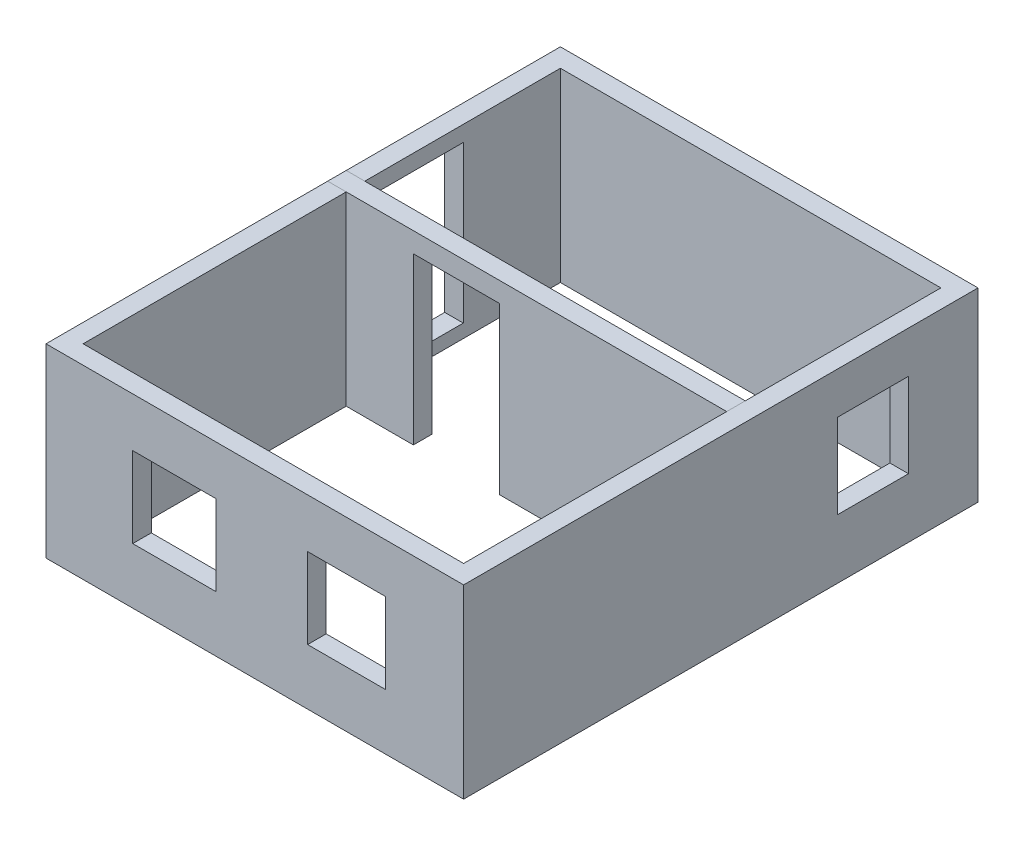
from build123d import *

# Parameters (mm, degrees)
EXTRUDE_1_OUTLINE_W   = 4500
EXTRUDE_1_OUTLINE_H   = 5543
EXTRUDE_1_OUTLINE_W_2 = 4100
EXTRUDE_1_OUTLINE_H_2 = 5143
EXTRUDE_1_DEPTH       = 2000
EXTRUDE_1_2_OUTLINE_W = 4500
EXTRUDE_1_2_OUTLINE_H = 200
EXTRUDE_1_2_DEPTH     = 2000
SKETCH_3_W            = 894.880767268
SKETCH_3_H            = 867.76316826
SKETCH_3_W_2          = 840.645569252
CUT_EXTRUDE_1_DEPTH   = 200
SKETCH_4_W            = 926.281817019
SKETCH_4_H            = 1784.625837091
CUT_EXTRUDE_2_DEPTH   = 200
SKETCH_5_W            = 766.917931954
SKETCH_5_H            = 909.345547887
CUT_EXTRUDE_3_DEPTH   = 200
SKETCH_6_W            = 930.561753535
SKETCH_6_H            = 1685.729668706
CUT_EXTRUDE_4_DEPTH   = 200


# Read off the part's stored shape, not the designer's step: Вытянуть-Тонкостенный1
with BuildPart() as part:
    # Вытянуть-Тонкостенный1 outline → Вытянуть-Тонкостенный1 (new body)
    with BuildSketch(Plane(origin=(0, 0, 0), x_dir=(-1, 0, 0), z_dir=(0, 1, 0))):
        with Locations((-2250, -2771.5)):
            Rectangle(EXTRUDE_1_OUTLINE_W, EXTRUDE_1_OUTLINE_H)
        with Locations((-2250, -2771.5)):
            Rectangle(EXTRUDE_1_OUTLINE_W_2, EXTRUDE_1_OUTLINE_H_2, mode=Mode.SUBTRACT)
    extrude(amount=EXTRUDE_1_DEPTH)

    # Эскиз3 → Вырез-Вытянуть1 (cut)
    with BuildSketch(Plane.XY):
        with Locations((1381.9214075, 1036.583100649)):
            Rectangle(SKETCH_3_W, SKETCH_3_H)
        with Locations((3239.476939556, 1036.583100649)):
            Rectangle(SKETCH_3_W_2, SKETCH_3_H)
    extrude(amount=-CUT_EXTRUDE_1_DEPTH, mode=Mode.SUBTRACT)

    # Эскиз5 → Вырез-Вытянуть3 (cut)
    with BuildSketch(Plane(origin=(4500, 0, 0), x_dir=(0, 0, -1), z_dir=(1, 0, 0))):
        with Locations((4410.423442282, 1095.014257943)):
            Rectangle(SKETCH_5_W, SKETCH_5_H)
    extrude(amount=-CUT_EXTRUDE_3_DEPTH, mode=Mode.SUBTRACT)

    # Эскиз6 → Вырез-Вытянуть4 (cut)
    with BuildSketch(Plane.ZY):
        with Locations((-3831.171106774, 987.819872336)):
            Rectangle(SKETCH_6_W, SKETCH_6_H)
    extrude(amount=-CUT_EXTRUDE_4_DEPTH, mode=Mode.SUBTRACT)


with BuildPart() as body_2:
    # Extrude 1 2 outline → Extrude 1 2 (new body)
    with BuildSketch(Plane(origin=(0, 0, 0), x_dir=(-1, 0, 0), z_dir=(0, 1, 0))):
        with Locations((-2250, -3135.044271929)):
            Rectangle(EXTRUDE_1_2_OUTLINE_W, EXTRUDE_1_2_OUTLINE_H)
    extrude(amount=EXTRUDE_1_2_DEPTH)

    # Эскиз4 → Вырез-Вытянуть2 (cut)
    with BuildSketch(Plane.XY.offset(-3035.044271929)):
        with Locations((1386.631071625, 892.312918546)):
            Rectangle(SKETCH_4_W, SKETCH_4_H)
    extrude(amount=-CUT_EXTRUDE_2_DEPTH, mode=Mode.SUBTRACT)


solid = Compound([part.part, body_2.part])
